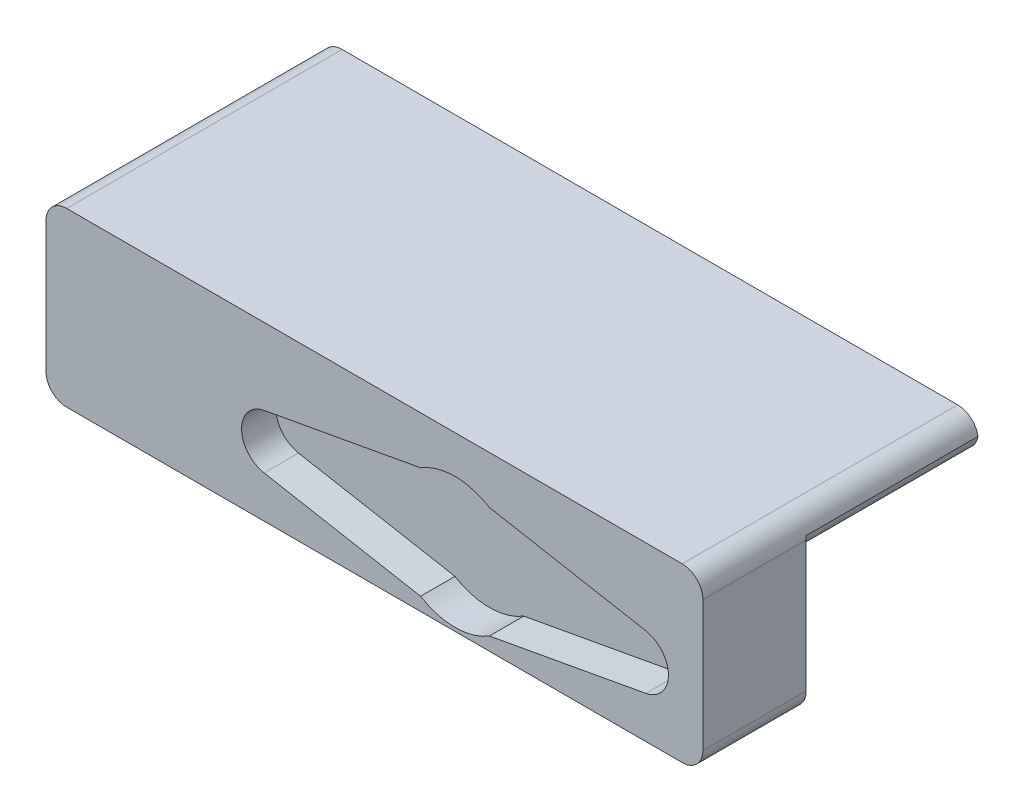
from build123d import *

# Parameters (mm, degrees)
SKETCH1_W                       = 75.438
SKETCH1_H                       = 12.7
BOSS_EXTRUDE1_DEPTH             = 6.35
CUT_EXTRUDE1_DEPTH              = 3.175
BOSS_EXTRUDE2_REACH             = 40.773
SKETCH3_W                       = 75.438
SKETCH3_H                       = 19.05
SKETCH3_W_2                     = 69.088
SKETCH3_H_2                     = 12.7
BOSS_EXTRUDE2_DIRECTION_2_REACH = 40.773
SKETCH4_W                       = 75.438
SKETCH4_H                       = 25.4
BOSS_EXTRUDE4_DEPTH             = 3.175
SKETCH7_W                       = 14.859
SKETCH7_H                       = 15.875
CUT_EXTRUDE3_DEPTH              = 47.460828512
SKETCH8_W                       = 3.175
SKETCH8_H                       = 15.875
CUT_EXTRUDE4_DEPTH              = 65.214043371
BOSS_EXTRUDE5_DEPTH             = 3.175
FILLET2_R                       = 1.905


with BuildPart() as part:
    # Sketch1 → Boss-Extrude1 (new body)
    with BuildSketch(Plane.XY):
        Rectangle(SKETCH1_W, SKETCH1_H)
    extrude(amount=BOSS_EXTRUDE1_DEPTH)

    # Sketch2 → Cut-Extrude1 (cut)
    with BuildSketch(Plane.XY.offset(6.35)):
        with BuildLine():
            Line((3.175, 5.129369479), (17.6006647, 2.498793645))
            ThreePointArc((17.6006647, 2.498793645), (19.685, 0), (17.6006647, -2.498793645))
            Line((17.6006647, -2.498793645), (3.175, -5.129369479))
            ThreePointArc((3.175, -5.129369479), (0, -6.0325), (-3.175, -5.129369479))
            Line((-3.175, -5.129369479), (-17.6006647, -2.498793645))
            ThreePointArc((-17.6006647, -2.498793645), (-19.685, 0), (-17.6006647, 2.498793645))
            Line((-17.6006647, 2.498793645), (-3.175, 5.129369479))
            ThreePointArc((-3.175, 5.129369479), (0, 6.0325), (3.175, 5.129369479))
        make_face()
    extrude(amount=-CUT_EXTRUDE1_DEPTH, mode=Mode.SUBTRACT)

    # Boss-Extrude2: up to this face of the body (flat: up to its plane)
    boss_extrude2_end = Plane(part.part.faces().sort_by_distance((0, 6.35, 3.175))[0])
    # Sketch3 → Boss-Extrude2 (add, up to the picked face)
    with BuildSketch(Plane(origin=(0, 0, 0), x_dir=(1, 0, 0), z_dir=(0, 1, 0)), mode=Mode.PRIVATE) as boss_extrude2_sk1:
        with Locations((0, 9.525)):
            Rectangle(SKETCH3_W, SKETCH3_H)
        with Locations((0, 9.525)):
            Rectangle(SKETCH3_W_2, SKETCH3_H_2, mode=Mode.SUBTRACT)
    boss_extrude2_tool1 = split(extrude(boss_extrude2_sk1.sketch, amount=BOSS_EXTRUDE2_REACH, mode=Mode.PRIVATE), bisect_by=boss_extrude2_end, keep=Keep.BOTH, mode=Mode.PRIVATE)
    add(boss_extrude2_tool1.solids().sort_by(Axis((0, 0, -0.778061), (0, 1, 0)))[0])

    # Boss-Extrude2 direction 2: up to this face of the body (flat: up to its plane)
    boss_extrude2_direction_2_end = Plane(part.part.faces().sort_by_distance((0, -6.35, 3.175))[0])
    # Sketch3 → Boss-Extrude2 direction 2 (add, up to the picked face)
    with BuildSketch(Plane(origin=(0, 0, 0), x_dir=(1, 0, 0), z_dir=(0, 1, 0)), mode=Mode.PRIVATE) as boss_extrude2_direction_2_sk1:
        with Locations((0, 9.525)):
            Rectangle(SKETCH3_W, SKETCH3_H)
        with Locations((0, 9.525)):
            Rectangle(SKETCH3_W_2, SKETCH3_H_2, mode=Mode.SUBTRACT)
    boss_extrude2_direction_2_tool1 = split(extrude(boss_extrude2_direction_2_sk1.sketch, amount=-BOSS_EXTRUDE2_DIRECTION_2_REACH, mode=Mode.PRIVATE), bisect_by=boss_extrude2_direction_2_end, keep=Keep.BOTH, mode=Mode.PRIVATE)
    add(boss_extrude2_direction_2_tool1.solids().sort_by(Axis((0, 0, -0.778061), (0, -1, 0)))[0])

    # Sketch4 → Boss-Extrude4 (add)
    with BuildSketch(Plane(origin=(0, 6.35, 0), x_dir=(1, 0, 0), z_dir=(0, 1, 0))):
        with Locations((0, 6.35)):
            Rectangle(SKETCH4_W, SKETCH4_H)
    extrude(amount=BOSS_EXTRUDE4_DEPTH)

    # Sketch7 → Cut-Extrude3 (cut, through all)
    with BuildSketch(Plane.XY.offset(6.35)):
        with Locations((30.2895, 1.5875)):
            Rectangle(SKETCH7_W, SKETCH7_H)
    extrude(amount=-CUT_EXTRUDE3_DEPTH, mode=Mode.SUBTRACT)

    # Sketch8 → Cut-Extrude4 (cut, through all)
    with BuildSketch(Plane(origin=(22.86, 0, 0), x_dir=(0, 0, -1), z_dir=(1, 0, 0))):
        with Locations((17.4625, 1.5875)):
            Rectangle(SKETCH8_W, SKETCH8_H)
    extrude(amount=-CUT_EXTRUDE4_DEPTH, mode=Mode.SUBTRACT)

    # Sketch9 → Boss-Extrude5 (add)
    with BuildSketch(Plane(origin=(0, 0, -15.875), x_dir=(-1, 0, 0), z_dir=(0, 0, -1))):
        Polygon((34.544, 6.35), (34.544, -6.35), (37.719, -6.35), (37.719, 9.525), (-22.86, 9.525), (-22.86, 6.35), align=None)
    extrude(amount=BOSS_EXTRUDE5_DEPTH)

    # Fillet2
    # the kernel refuses this fillet: 1.905 mm, written as the material it adds along each edge
    with BuildSketch(Plane(origin=(-34.544, 6.35, 1.5875), x_dir=(0, -1, 0), z_dir=(0, 0, -1))) as fillet2_piece_1:
        with BuildLine():
            CenterArc((FILLET2_R, -FILLET2_R), FILLET2_R, 90, 90)
            Line((0, -FILLET2_R), (0, 0))
            Line((0, 0), (FILLET2_R, 0))
        make_face()
    extrude(amount=20.6375)
    # the kernel refuses this fillet: 1.905 mm, written as the material it takes off along each edge
    with BuildSketch(Plane(origin=(-37.719, 9.525, 11.1125), x_dir=(0, -1, 0), z_dir=(0, 0, -1)), Plane(origin=(-37.719, -6.35, 11.1125), x_dir=(1, 0, 0), z_dir=(0, 0, -1))) as fillet2_2_piece_1:
        with BuildLine():
            CenterArc((FILLET2_R, -FILLET2_R), FILLET2_R, 90, 90)
            Line((0, -FILLET2_R), (0, 0))
            Line((0, 0), (FILLET2_R, 0))
        make_face()
    extrude(amount=34.925, mode=Mode.SUBTRACT)
    with BuildSketch(Plane(origin=(-34.544, -6.35, -3.175), x_dir=(0, 1, 0), z_dir=(0, 0, -1))) as fillet2_2_piece_2:
        with BuildLine():
            CenterArc((FILLET2_R, -FILLET2_R), FILLET2_R, 90, 90)
            Line((0, -FILLET2_R), (0, 0))
            Line((0, 0), (FILLET2_R, 0))
        make_face()
    extrude(amount=20.6375, mode=Mode.SUBTRACT)
    with BuildSketch(Plane(origin=(22.86, 6.35, -23.8125), x_dir=(0, 1, 0), z_dir=(0, 0, 1))) as fillet2_2_piece_3:
        with BuildLine():
            CenterArc((FILLET2_R, FILLET2_R), FILLET2_R, 180, 90)
            Line((0, FILLET2_R), (0, 0))
            Line((0, 0), (FILLET2_R, 0))
        make_face()
    extrude(amount=20.6375, mode=Mode.SUBTRACT)
    with BuildSketch(Plane(origin=(22.86, 9.525, -23.8125), x_dir=(-1, 0, 0), z_dir=(0, 0, 1))) as fillet2_2_piece_4:
        with BuildLine():
            CenterArc((FILLET2_R, FILLET2_R), FILLET2_R, 180, 90)
            Line((0, FILLET2_R), (0, 0))
            Line((0, 0), (FILLET2_R, 0))
        make_face()
    extrude(amount=34.925, mode=Mode.SUBTRACT)
    with BuildSketch(Plane(origin=(22.86, -6.35, 11.1125), x_dir=(-1, 0, 0), z_dir=(0, 0, -1))) as fillet2_2_piece_5:
        with BuildLine():
            CenterArc((FILLET2_R, FILLET2_R), FILLET2_R, 180, 90)
            Line((0, FILLET2_R), (0, 0))
            Line((0, 0), (FILLET2_R, 0))
        make_face()
    extrude(amount=19.05, mode=Mode.SUBTRACT)


solid = part.part
